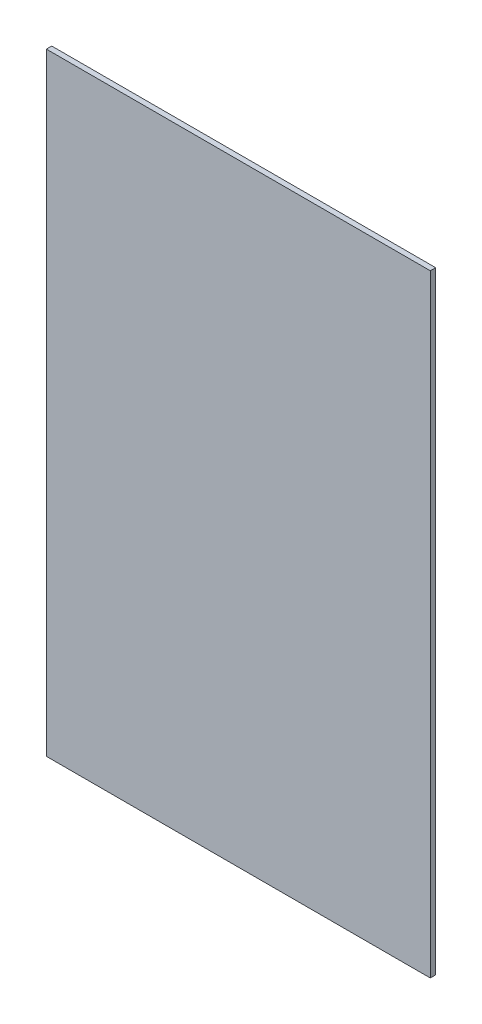
from build123d import *

# Parameters (mm, degrees)
SKETCH1_W          = 215
SKETCH1_H          = 343
BASE_FLANGE1_DEPTH = 3


# Sheet-metal steps are written as plain solids
with BuildPart() as part:
    # Sketch1 → Base-Flange1 (new body)
    with BuildSketch(Plane(origin=(0, 0, -122.5), x_dir=(-1, 0, 0), z_dir=(0, 0, -1))):
        with Locations((0, 158.5)):
            Rectangle(SKETCH1_W, SKETCH1_H)
    extrude(amount=BASE_FLANGE1_DEPTH)


solid = part.part
